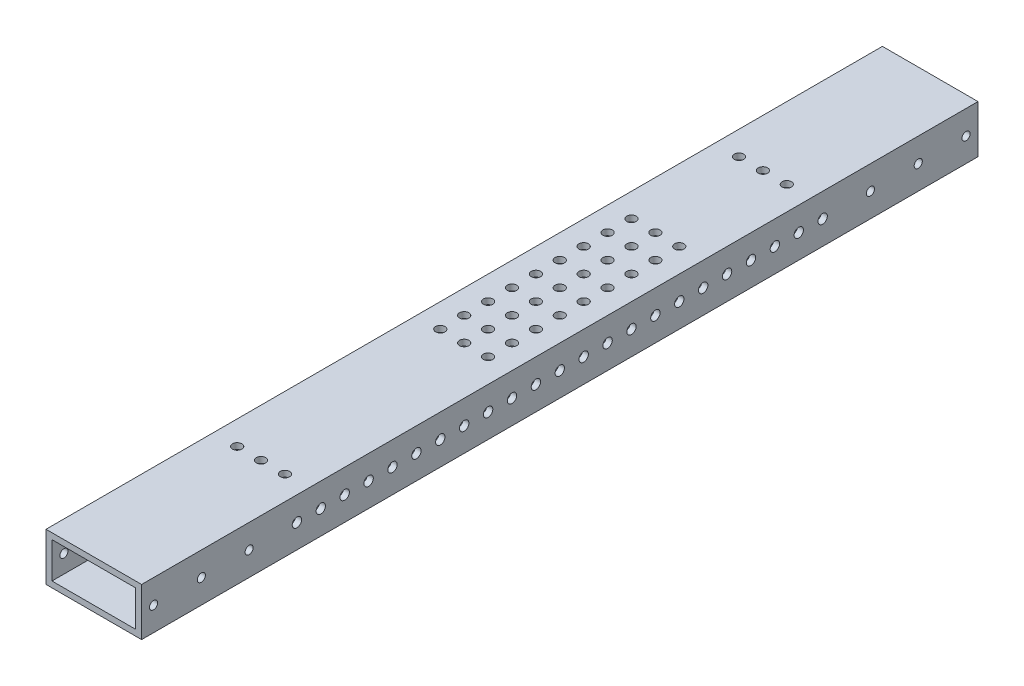
from build123d import *

# Parameters (mm, degrees)
SKETCH1_W           = 50.8
SKETCH1_H           = 25.4
SKETCH1_W_2         = 44.45
SKETCH1_H_2         = 19.05
BOSS_EXTRUDE1_DEPTH = 222.25
SKETCH3_R           = 2.15265
SKETCH3_R_2         = 2.159
CUT_EXTRUDE2_DEPTH  = 229.335263374
SKETCH4_R           = 2.4892
CUT_EXTRUDE3_DEPTH  = 229.335263374
SKETCH5_R           = 2.4892
CUT_EXTRUDE4_DEPTH  = 226.134143346


with BuildPart() as part:
    # Sketch1 → Boss-Extrude1 (new, symmetric)
    with BuildSketch(Plane.XY):
        Rectangle(SKETCH1_W, SKETCH1_H)
        Rectangle(SKETCH1_W_2, SKETCH1_H_2, mode=Mode.SUBTRACT)
    extrude(amount=BOSS_EXTRUDE1_DEPTH, both=True)

    # Sketch3 → Cut-Extrude2 (cut, through all)
    with BuildSketch(Plane(origin=(25.4, 0, 0), x_dir=(0, 0, -1), z_dir=(1, 0, 0))):
        with Locations((-215.9, 0)):
            Circle(SKETCH3_R)
        with Locations((-190.5, 0)):
            Circle(SKETCH3_R)
        with Locations((-165.1, 0)):
            Circle(SKETCH3_R)
        with Locations((215.9, 0)):
            Circle(SKETCH3_R_2)
        with Locations((190.5, 0)):
            Circle(SKETCH3_R_2)
        with Locations((165.1, 0)):
            Circle(SKETCH3_R_2)
    extrude(amount=-CUT_EXTRUDE2_DEPTH, mode=Mode.SUBTRACT)

    # Sketch4 → Cut-Extrude3 (cut, through all)
    with BuildSketch(Plane(origin=(25.4, 0, 0), x_dir=(0, 0, -1), z_dir=(1, 0, 0))):
        with Locations((-139.7, 0)):
            Circle(SKETCH4_R)
        with Locations((-127, 0)):
            Circle(SKETCH4_R)
        with Locations((-114.3, 0)):
            Circle(SKETCH4_R)
        with Locations((-101.6, 0)):
            Circle(SKETCH4_R)
        with Locations((-88.9, 0)):
            Circle(SKETCH4_R)
        with Locations((-76.2, 0)):
            Circle(SKETCH4_R)
        with Locations((-63.5, 0)):
            Circle(SKETCH4_R)
        with Locations((-50.8, 0)):
            Circle(SKETCH4_R)
        with Locations((-38.1, 0)):
            Circle(SKETCH4_R)
        with Locations((-25.4, 0)):
            Circle(SKETCH4_R)
        with Locations((-12.7, 0)):
            Circle(SKETCH4_R)
        Circle(SKETCH4_R)
        with Locations((12.7, 0)):
            Circle(SKETCH4_R)
        with Locations((25.4, 0)):
            Circle(SKETCH4_R)
        with Locations((38.1, 0)):
            Circle(SKETCH4_R)
        with Locations((50.8, 0)):
            Circle(SKETCH4_R)
        with Locations((63.5, 0)):
            Circle(SKETCH4_R)
        with Locations((76.2, 0)):
            Circle(SKETCH4_R)
        with Locations((88.9, 0)):
            Circle(SKETCH4_R)
        with Locations((101.6, 0)):
            Circle(SKETCH4_R)
        with Locations((114.3, 0)):
            Circle(SKETCH4_R)
        with Locations((127, 0)):
            Circle(SKETCH4_R)
        with Locations((139.7, 0)):
            Circle(SKETCH4_R)
    extrude(amount=-CUT_EXTRUDE3_DEPTH, mode=Mode.SUBTRACT)

    # Sketch5 → Cut-Extrude4 (cut, through all)
    with BuildSketch(Plane.XZ.offset(12.7)):
        with Locations((-12.7, 133.35)):
            Circle(SKETCH5_R)
        with Locations((0, 133.35)):
            Circle(SKETCH5_R)
        with Locations((12.7, 133.35)):
            Circle(SKETCH5_R)
        with Locations((12.7, -133.35)):
            Circle(SKETCH5_R)
        with Locations((0, -133.35)):
            Circle(SKETCH5_R)
        with Locations((-12.7, -133.35)):
            Circle(SKETCH5_R)
        with Locations((-12.7, 25.4)):
            Circle(SKETCH5_R)
        with Locations((0, 25.4)):
            Circle(SKETCH5_R)
        with Locations((12.7, 25.4)):
            Circle(SKETCH5_R)
        with Locations((12.7, 12.7)):
            Circle(SKETCH5_R)
        with Locations((0, 12.7)):
            Circle(SKETCH5_R)
        with Locations((-12.7, 12.7)):
            Circle(SKETCH5_R)
        with Locations((12.7, 0)):
            Circle(SKETCH5_R)
        Circle(SKETCH5_R)
        with Locations((-12.7, 0)):
            Circle(SKETCH5_R)
        with Locations((12.7, -12.7)):
            Circle(SKETCH5_R)
        with Locations((0, -12.7)):
            Circle(SKETCH5_R)
        with Locations((-12.7, -12.7)):
            Circle(SKETCH5_R)
        with Locations((12.7, -25.4)):
            Circle(SKETCH5_R)
        with Locations((0, -25.4)):
            Circle(SKETCH5_R)
        with Locations((-12.7, -25.4)):
            Circle(SKETCH5_R)
        with Locations((12.7, -38.1)):
            Circle(SKETCH5_R)
        with Locations((0, -38.1)):
            Circle(SKETCH5_R)
        with Locations((-12.7, -38.1)):
            Circle(SKETCH5_R)
        with Locations((12.7, -50.8)):
            Circle(SKETCH5_R)
        with Locations((0, -50.8)):
            Circle(SKETCH5_R)
        with Locations((-12.7, -50.8)):
            Circle(SKETCH5_R)
        with Locations((12.7, -63.5)):
            Circle(SKETCH5_R)
        with Locations((0, -63.5)):
            Circle(SKETCH5_R)
        with Locations((-12.7, -63.5)):
            Circle(SKETCH5_R)
        with Locations((12.7, -76.2)):
            Circle(SKETCH5_R)
        with Locations((0, -76.2)):
            Circle(SKETCH5_R)
        with Locations((-12.7, -76.2)):
            Circle(SKETCH5_R)
    extrude(amount=-CUT_EXTRUDE4_DEPTH, mode=Mode.SUBTRACT)


solid = part.part
